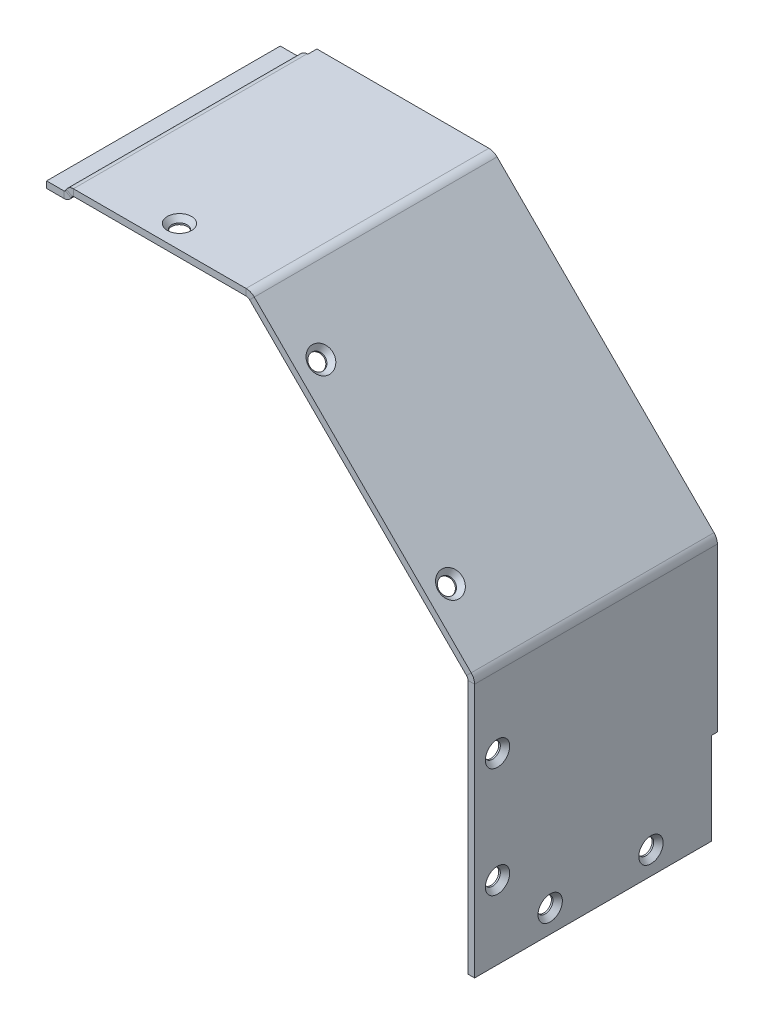
from build123d import *

# Parameters (mm, degrees)
BASE_FLANGE1_DEPTH                            = 84.1502
CSK_FOR_8_FLAT_HEAD_MACHINE_SCREW1_AT_2_COUNT = 2
CSK_FOR_8_FLAT_HEAD_MACHINE_SCREW1_AT_2_PITCH = 34.925
CSK_FOR_8_FLAT_HEAD_MACHINE_SCREW2_AT_2_COUNT = 2
CSK_FOR_8_FLAT_HEAD_MACHINE_SCREW2_AT_2_PITCH = 38.1
CSK_FOR_8_FLAT_HEAD_MACHINE_SCREW3_AT_2_COUNT = 2
CSK_FOR_8_FLAT_HEAD_MACHINE_SCREW3_AT_2_PITCH = 63.5
SKETCH13_W                                    = 37.425471778
SKETCH13_H                                    = 23.818222608
CUT_EXTRUDE2_DEPTH                            = 7.62
CUT_EXTRUDE3_DEPTH                            = 31.75


# Read off the part's stored shape, not the designer's step: Base-Flange1
with BuildPart() as part:
    # Base-Flange1 outline → Base-Flange1 (new body)
    with BuildSketch(Plane.XY):
        with BuildLine():
            Line((-0.293293937, 139.7), (-6.35, 139.7))
            Line((-6.35, 139.7), (-6.35, 137.414))
            Line((-6.35, 137.414), (-0.293293937, 137.414))
            ThreePointArc((-0.293293937, 137.414), (1.103706063, 137.788325022), (2.126381041, 138.811))
            Line((2.126381041, 138.811), (2.492998462, 139.446))
            ThreePointArc((2.492998462, 139.446), (2.678939367, 139.631940905), (2.932939367, 139.7))
            Line((2.932939367, 139.7), (62.784570335, 139.7))
            ThreePointArc((62.784570335, 139.7), (63.44554116, 139.568524729), (64.005885168, 139.194114832))
            Line((64.005885168, 139.194114832), (139.194114832, 64.005885168))
            ThreePointArc((139.194114832, 64.005885168), (139.568524729, 63.44554116), (139.7, 62.784570335))
            Line((139.7, 62.784570335), (139.7, -25.4))
            Line((139.7, -25.4), (141.986, -25.4))
            Line((141.986, -25.4), (141.986, 62.784570335))
            ThreePointArc((141.986, 62.784570335), (141.68051334, 64.320355486), (140.810560934, 65.622331269))
            Line((140.810560934, 65.622331269), (65.622331269, 140.810560934))
            ThreePointArc((65.622331269, 140.810560934), (64.320355486, 141.68051334), (62.784570335, 141.986))
            Line((62.784570335, 141.986), (2.932939367, 141.986))
            ThreePointArc((2.932939367, 141.986), (1.535939367, 141.611674978), (0.513264389, 140.589))
            Line((0.513264389, 140.589), (0.146646968, 139.954))
            ThreePointArc((0.146646968, 139.954), (-0.039293937, 139.768059095), (-0.293293937, 139.7))
        make_face()
    extrude(amount=BASE_FLANGE1_DEPTH)

    # Sketch2 → CSK for #8 Flat Head Machine Screw1 (revolve, cut)
    with BuildSketch(Plane(origin=(141.986, -17.4498, 57.9501), x_dir=(0, 0, -1), z_dir=(0, 1, 0))):
        Polygon((0, 0), (0, 2.286), (2.7051, 2.286), (2.7051, 1.738551774), (4.2164, 0), align=None)
    csk_for_8_flat_head_machine_screw1 = revolve(axis=Axis((148.336, -17.4498, 57.9501), (-1, 0, 0)), mode=Mode.SUBTRACT)

    # CSK for #8 Flat Head Machine Screw1 at 2: CSK for #8 Flat Head Machine Screw1 ×2
    with Locations(*[(0, 0, -i * CSK_FOR_8_FLAT_HEAD_MACHINE_SCREW1_AT_2_PITCH) for i in range(1, CSK_FOR_8_FLAT_HEAD_MACHINE_SCREW1_AT_2_COUNT)]):
        add(csk_for_8_flat_head_machine_screw1, mode=Mode.SUBTRACT)

    # Sketch6 → CSK for #8 Flat Head Machine Screw2 (revolve, cut)
    with BuildSketch(Plane(origin=(141.986, 0, 76.2), x_dir=(0, 0, -1), z_dir=(0, 1, 0))):
        Polygon((0, 0), (0, 2.286), (2.7051, 2.286), (2.7051, 1.738551774), (4.2164, 0), align=None)
    csk_for_8_flat_head_machine_screw2 = revolve(axis=Axis((148.336, 0, 76.2), (-1, 0, 0)), mode=Mode.SUBTRACT)

    # CSK for #8 Flat Head Machine Screw2 at 2: CSK for #8 Flat Head Machine Screw2 ×2
    with Locations(*[(0, i * CSK_FOR_8_FLAT_HEAD_MACHINE_SCREW2_AT_2_PITCH, 0) for i in range(1, CSK_FOR_8_FLAT_HEAD_MACHINE_SCREW2_AT_2_COUNT)]):
        add(csk_for_8_flat_head_machine_screw2, mode=Mode.SUBTRACT)

    # Sketch8 → CSK for #8 Flat Head Machine Screw3 (revolve, cut)
    with BuildSketch(Plane(origin=(125.672839939, 80.760052265, 76.2), x_dir=(-0.707106781186544, 0.7071067811865511, 0), z_dir=(0, 0, 1))):
        Polygon((0, 0), (0, 2.286), (2.7051, 2.286), (2.7051, 1.738551774), (4.2164, 0), align=None)
    csk_for_8_flat_head_machine_screw3 = revolve(axis=Axis((130.162967999, 85.250180325, 76.2), (-0.707106781186551, -0.707106781186544, 0)), mode=Mode.SUBTRACT)

    # CSK for #8 Flat Head Machine Screw3 at 2: CSK for #8 Flat Head Machine Screw3 ×2
    with Locations(*[Vector(-0.707106781186544, 0.707106781186551, 0) * (i * CSK_FOR_8_FLAT_HEAD_MACHINE_SCREW3_AT_2_PITCH) for i in range(1, CSK_FOR_8_FLAT_HEAD_MACHINE_SCREW3_AT_2_COUNT)]):
        add(csk_for_8_flat_head_machine_screw3, mode=Mode.SUBTRACT)

    # Sketch10 → CSK for #8 Flat Head Machine Screw4 (revolve, cut)
    with BuildSketch(Plane(origin=(31.75, 141.986, 76.2), x_dir=(0, 0, 1), z_dir=(1, 0, 0))):
        Polygon((0, 0), (0, 2.286), (2.7051, 2.286), (2.7051, 1.738551774), (4.2164, 0), align=None)
    revolve(axis=Axis((31.75, 148.336, 76.2), (0, -1, 0)), mode=Mode.SUBTRACT)

    # Sketch13 → Cut-Extrude2 (cut)
    with BuildSketch(Plane(origin=(0, 141.986, 0), x_dir=(1, 0, 0), z_dir=(0, 1, 0))):
        with Locations((-15.537735889, 8.734111304)):
            Rectangle(SKETCH13_W, SKETCH13_H)
    extrude(amount=-CUT_EXTRUDE2_DEPTH, mode=Mode.SUBTRACT)

    # Sketch14 → Cut-Extrude3 (cut)
    with BuildSketch(Plane.XZ.offset(25.4)):
        Polygon((148.11255662, 7.890869199), (135.614154543, -4.139010601), (148.11255662, -4.61665654), align=None)
    extrude(amount=-CUT_EXTRUDE3_DEPTH, mode=Mode.SUBTRACT)


solid = part.part
